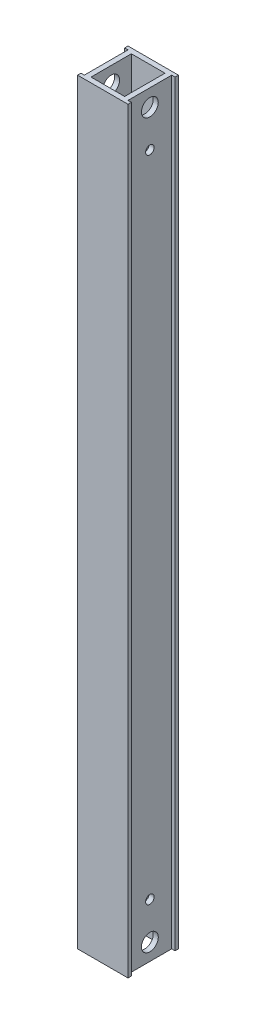
from build123d import *

# Parameters (mm, degrees)
SKETCH_1_W          = 30
SKETCH_1_H          = 450
EXTRUDE_1_DEPTH     = 30
SKETCH_2_W          = 2
SKETCH_2_H          = 26
CUT_EXTRUDE_1_DEPTH = 452.248268695
SHELL_1_T           = -3
SKETCH_5_R          = 5
CUT_EXTRUDE_2_DEPTH = 30
SKETCH_6_R          = 2.55
CUT_EXTRUDE_3_DEPTH = 5


with BuildPart() as part:
    # 草图1 → 凸台-拉伸1 (new body)
    with BuildSketch(Plane.XY):
        Rectangle(SKETCH_1_W, SKETCH_1_H)
    extrude(amount=EXTRUDE_1_DEPTH)

    # 草图2 → 切除-拉伸1 (cut, through all)
    with BuildSketch(Plane(origin=(0, 225, 0), x_dir=(1, 0, 0), z_dir=(0, 1, 0))):
        with Locations((-14, -15)):
            Rectangle(SKETCH_2_W, SKETCH_2_H)
        with Locations((14, -15)):
            Rectangle(SKETCH_2_W, SKETCH_2_H)
    extrude(amount=-CUT_EXTRUDE_1_DEPTH, mode=Mode.SUBTRACT)

    # 抽壳1
    shell_1_openings = [part.faces().sort_by_distance(p)[0] for p in [
        (0, -225, 15),
        (0, 225, 15),
    ]]
    offset(amount=SHELL_1_T, openings=shell_1_openings)

    # 草图5 → 切除-拉伸2 (cut)
    with BuildSketch(Plane(origin=(13, 0, 0), x_dir=(0, 0, -1), z_dir=(1, 0, 0))):
        with Locations((-15, 215)):
            Circle(SKETCH_5_R)
        with Locations((-15, -215)):
            Circle(SKETCH_5_R)
    extrude(amount=-CUT_EXTRUDE_2_DEPTH, mode=Mode.SUBTRACT)

    # 草图6 → 切除-拉伸3 (cut)
    with BuildSketch(Plane(origin=(13, 0, 0), x_dir=(0, 0, -1), z_dir=(1, 0, 0))):
        with Locations((-15, 193)):
            Circle(SKETCH_6_R)
    cut_extrude_3 = extrude(amount=-CUT_EXTRUDE_3_DEPTH, mode=Mode.SUBTRACT)

    # 镜向1: 切除-拉伸3 across plane
    add(cut_extrude_3.mirror(Plane.ZX), mode=Mode.SUBTRACT)


solid = part.part
